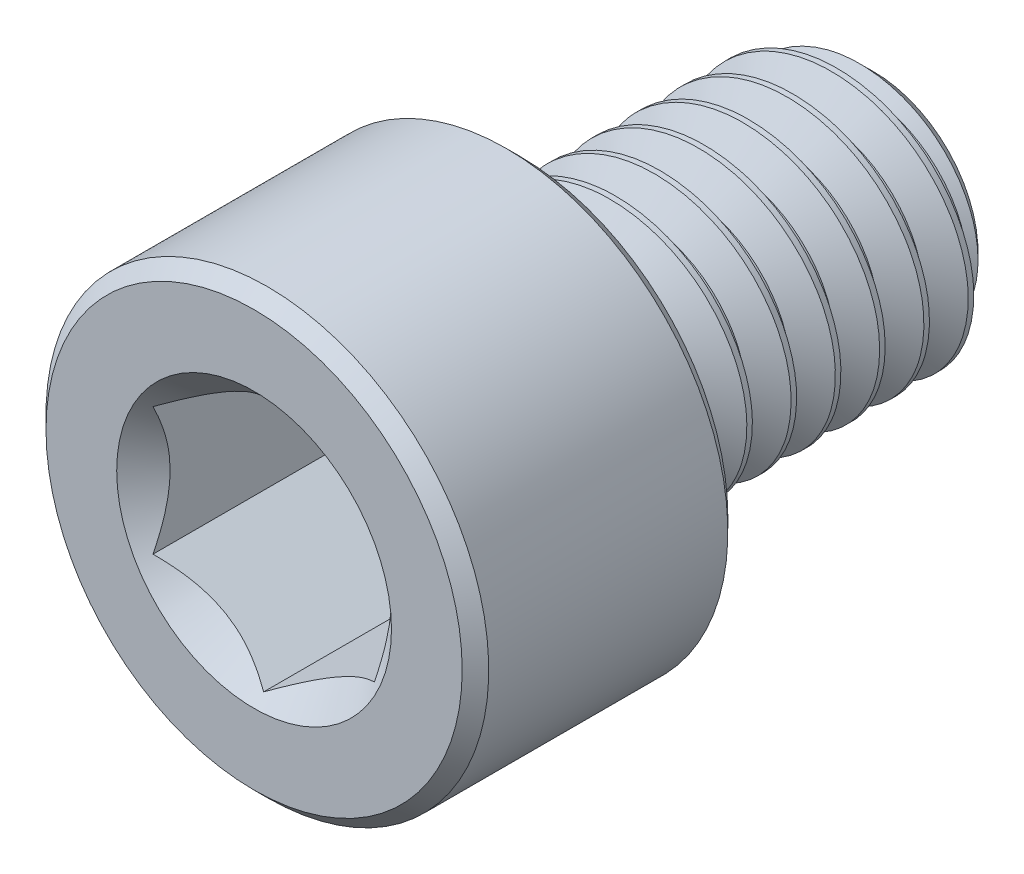
from build123d import *

# Parameters (mm, degrees)
CUT_EXTRUDE1_DEPTH     = 5
SKETCH4_R              = 3.103257697
CUT_EXTRUDE2_DEPTH     = 3
CUT_EXTRUDE2_DRAFT     = -45
SPLIT1_SURFACE_1_BACK  = 20.9
SPLIT1_SURFACE_1_DEPTH = 41.8
SPLIT1_SURFACE_2_BACK  = 20.9
SPLIT1_SURFACE_2_DEPTH = 41.8
CUT_SWEEP1_PITCH       = 1


with BuildPart() as part:
    # Sketch2 → Revolve1 (revolve)
    with BuildSketch(Plane(origin=(0, 0, 0), x_dir=(0, 0, -1), z_dir=(1, 0, 0))):
        with BuildLine():
            Line((-7, 0), (-7, 4.7))
            Line((-7, 4.7), (-6.7, 5))
            Line((-6.7, 5), (-1.3, 5))
            Line((-1.3, 5), (-1, 4.7))
            Line((-1, 4.7), (-1, 3.3))
            ThreePointArc((-1, 3.3), (-0.912132034, 3.087867966), (-0.7, 3))
            Line((-0.7, 3), (6.350480947, 3))
            Line((6.350480947, 3), (7, 2.350480947))
            Line((7, 2.350480947), (7, 0))
            Line((7, 0), (-7, 0))
        make_face()
    revolve(axis=Axis((0, 0, -7), (0, 0, 1)))

    # Sketch3 → Cut-Extrude1 (cut)
    with BuildSketch(Plane.XY.offset(7)):
        Polygon((2.5, -1.443375673), (2.5, 1.443375673), (0, 2.886751346), (-2.5, 1.443375673), (-2.5, -1.443375673), (0, -2.886751346), align=None)
    extrude(amount=-CUT_EXTRUDE1_DEPTH, mode=Mode.SUBTRACT)


with BuildPart() as cut_extrude2_tool:
    # Sketch4 → Cut-Extrude2 (with draft: the straight prism first)
    with BuildSketch(Plane.XY.offset(7)):
        Circle(SKETCH4_R)
    extrude(amount=-CUT_EXTRUDE2_DEPTH)
    # Cut-Extrude2: the draft: its side faces are tilted about the plane it starts from
    cut_extrude2_sides = [cut_extrude2_tool.faces().sort_by_distance(p)[0] for p in [
        (-3.103257697, 0, 5.5),
    ]]
    draft(cut_extrude2_sides, Plane.XY.offset(7), CUT_EXTRUDE2_DRAFT)


with BuildPart() as part_1:
    add(part.part)

    # Cut-Extrude2: cut by cut_extrude2_tool
    add(cut_extrude2_tool.part, mode=Mode.SUBTRACT)


with BuildPart() as body_2:
    # Split1: the piece behind the surface
    add(part_1.part)
    # Split1 surface: a surface, the sketch's curves swept straight by 41.8 mm
    with BuildLine(Plane(origin=(0, 0, 0), x_dir=(0, 0, -1), z_dir=(1, 0, 0)).offset(-SPLIT1_SURFACE_1_BACK), mode=Mode.PRIVATE) as split1_surface_1_path:
        Line((-0.7, -5), (-0.7, 5))
    split1_surface_1 = Shell.extrude(split1_surface_1_path.wire(), (1 * SPLIT1_SURFACE_1_DEPTH, 0 * SPLIT1_SURFACE_1_DEPTH, 0 * SPLIT1_SURFACE_1_DEPTH))
    split(bisect_by=split1_surface_1, keep=Keep.BOTTOM)

    # Cut-Sweep1: the profile of Sketch7 screwed along a right-hand helix of 9 turns, 8 arcs to a turn; built about Z, then put on its axis
    cut_sweep1_z = Axis((0, 0, 0), (0, 0, 1))
    cut_sweep1_corners = [(3.054126588, 0, 0.03125), (3.054126588, 0, -0.90625), (2.350480947, 0, -0.5), (2.350480947, 0, -0.375)]
    with BuildLine(mode=Mode.PRIVATE) as cut_sweep1_profile:
        Line(cut_sweep1_corners[0], cut_sweep1_corners[1])
        Line(cut_sweep1_corners[1], cut_sweep1_corners[2])
        Line(cut_sweep1_corners[2], cut_sweep1_corners[3])
        Line(cut_sweep1_corners[3], cut_sweep1_corners[0])
    cut_sweep1_cap = Face(cut_sweep1_profile.wire())
    cut_sweep1_turn_angles = [0, 22.5, 45, 67.5, 90, 112.5, 135, 157.5, 180, 202.5, 225, 247.5, 270, 292.5, 315, 337.5, 360]
    cut_sweep1_turn_weights = [1, 0.9238795325112867, 1, 0.9238795325112867, 1, 0.9238795325112867, 1, 0.9238795325112867, 1, 0.9238795325112867, 1, 0.9238795325112867, 1, 0.9238795325112867, 1, 0.9238795325112867, 1]
    cut_sweep1_turn_rails = [Edge.make_bspline([Vector(p[0], p[1], 0).rotate(cut_sweep1_z, cut_sweep1_turn_angles[k]) / cut_sweep1_turn_weights[k] + Vector(0, 0, p[2] + CUT_SWEEP1_PITCH * cut_sweep1_turn_angles[k] / 360) for k in range(17)], [0, 0, 0, 1, 1, 2, 2, 3, 3, 4, 4, 5, 5, 6, 6, 7, 7, 8, 8, 8], 2, cut_sweep1_turn_weights) for p in cut_sweep1_corners]
    cut_sweep1_turn_sides = [Face.make_surface_from_curves(cut_sweep1_turn_rails[p[0]], cut_sweep1_turn_rails[p[1]]) for p in [(0, 1), (1, 2), (2, 3), (3, 0)]]
    cut_sweep1 = Plane(origin=(0, 0, -7), x_dir=(0, 1, 0), z_dir=(0, 0, 1)) * Solid(Shell([*[p.moved(Location((0, 0, CUT_SWEEP1_PITCH * i))) for i in range(9) for p in cut_sweep1_turn_sides], cut_sweep1_cap, cut_sweep1_cap.rotate(cut_sweep1_z, 3240).moved(Location((0, 0, CUT_SWEEP1_PITCH * 3240 / 360)))]))
    add(cut_sweep1, mode=Mode.SUBTRACT)


with BuildPart() as part_2:
    add(part_1.part)

    # Split1: split by a surface, the side it looks to stays
    # Split1 surface: a surface, the sketch's curves swept straight by 41.8 mm
    with BuildLine(Plane(origin=(0, 0, 0), x_dir=(0, 0, -1), z_dir=(1, 0, 0)).offset(-SPLIT1_SURFACE_2_BACK), mode=Mode.PRIVATE) as split1_surface_2_path:
        Line((-0.7, -5), (-0.7, 5))
    split1_surface_2 = Shell.extrude(split1_surface_2_path.wire(), (1 * SPLIT1_SURFACE_2_DEPTH, 0 * SPLIT1_SURFACE_2_DEPTH, 0 * SPLIT1_SURFACE_2_DEPTH))
    split(bisect_by=split1_surface_2, keep=Keep.TOP)

    add(body_2.part)  # Revolve2 merges body 2
    # Sketch8 → Revolve2 (revolve)
    with BuildSketch(Plane(origin=(0, 0, 0), x_dir=(0, 0, -1), z_dir=(1, 0, 0))):
        Polygon((-1, 0), (-1, 3), (-0.7, 3), (1.032050808, 0), align=None)
    revolve(axis=Axis((0, 0, -1.032050808), (0, 0, 1)))


solid = part_2.part
